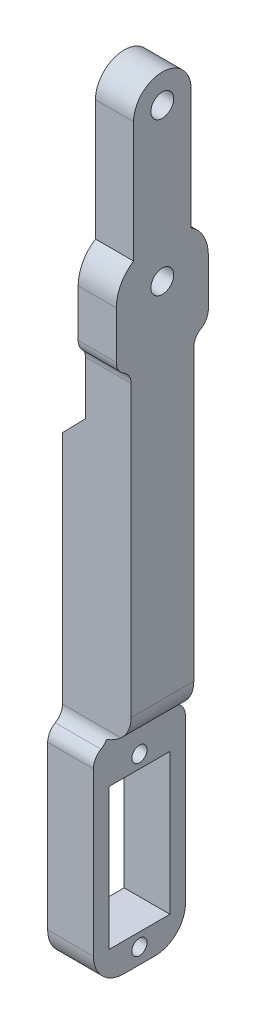
from build123d import *

# Parameters (mm, degrees)
SKETCH1_R               = 10
SKETCH1_R_2             = 0.8
SKETCH1_R_3             = 3.301767793
BOSS_EXTRUDE1_DEPTH     = 1.5
SKETCH2_R               = 10
BOSS_EXTRUDE2_DEPTH     = 9
CUT_EXTRUDE1_DEPTH      = 93.583714931
CUT_EXTRUDE1_DEPTH_BACK = 93.583714931
SKETCH3_R               = 1.5
FILLET1_R               = 5
SKETCH4_R               = 1.5
BOSS_EXTRUDE3_DEPTH     = 5
CUT_EXTRUDE2_DEPTH      = 4
FILLET3_R               = 2
SKETCH6_W               = 12.069016708
SKETCH6_H               = 36.150412664
BOSS_EXTRUDE4_DEPTH     = 9
CUT_EXTRUDE3_DEPTH      = 112.059195252
CUT_EXTRUDE3_DEPTH_BACK = 112.059195252
CUT_EXTRUDE4_DEPTH      = 111.336877259
CUT_EXTRUDE4_DEPTH_BACK = 111.336877259
SKETCH8_R               = 1
SKETCH8_W               = 8
SKETCH8_H               = 18.5
FILLET4_R               = 4
SKETCH9_W               = 24.382356312
SKETCH9_H               = 35.371587325
CUT_EXTRUDE5_DEPTH      = 3
FILLET5_R               = 4
SKETCH10_R              = 20.065343601
CUT_EXTRUDE6_DEPTH      = 3
CUT_EXTRUDE7_DEPTH      = 111.33687725
CUT_EXTRUDE7_DEPTH_BACK = 111.33687725
FILLET6_R               = 2
CHAMFER1_SIZE           = 3


# Some blends are built 0.0001 mm under size
with BuildPart() as part:
    # Sketch1 → Boss-Extrude1 (new body)
    with BuildSketch(Plane(origin=(0, 0, 0), x_dir=(0, 0, -1), z_dir=(1, 0, 0))):
        with Locations((2.983378847, 10.826778074)):
            Circle(SKETCH1_R)
        with Locations((2.983378847, 18.576778074)):
            Circle(SKETCH1_R_2, mode=Mode.SUBTRACT)
        with Locations((2.983378847, 3.076778074)):
            Circle(SKETCH1_R_2, mode=Mode.SUBTRACT)
        with Locations((-3.266621153, 10.826778074)):
            Circle(SKETCH1_R_2, mode=Mode.SUBTRACT)
        with Locations((9.233378847, 10.826778074)):
            Circle(SKETCH1_R_2, mode=Mode.SUBTRACT)
        with Locations((2.983378847, 10.826778074)):
            Circle(SKETCH1_R_3, mode=Mode.SUBTRACT)
    extrude(amount=BOSS_EXTRUDE1_DEPTH)

    # Sketch2 → Boss-Extrude2 (add)
    with BuildSketch(Plane.ZY):
        with BuildLine():
            Line((-15.531923741, 90.826778074), (9.565166047, 90.826778074))
            Line((9.565166047, 90.826778074), (9.565166047, 10.826778074))
            ThreePointArc((9.565166047, 10.826778074), (-2.983378847, -1.721766821), (-15.531923741, 10.826778074))
            Line((-15.531923741, 10.826778074), (-15.531923741, 90.826778074))
        make_face()
        with Locations((-2.983378847, 10.826778074)):
            Circle(SKETCH2_R, mode=Mode.SUBTRACT)
    extrude(amount=-BOSS_EXTRUDE2_DEPTH)

    # Sketch3 → Cut-Extrude1 (cut, two sides: drawn at the far end of the back side and taken through both)
    with BuildSketch(Plane(origin=(9, 0, 0), x_dir=(0, 0, -1), z_dir=(1, 0, 0)).offset(-CUT_EXTRUDE1_DEPTH_BACK)):
        with Locations((2.983378847, 85.826778074)):
            Circle(SKETCH3_R)
        with BuildLine():
            Line((-3.051129507, 36.150412664), (-3.051129507, 97.572569437))
            Line((-3.051129507, 97.572569437), (-16.389018159, 97.572569437))
            Line((-16.389018159, 97.572569437), (-16.389018159, 8.14109285))
            Line((-16.389018159, 8.14109285), (-9.565166047, 10.826778074))
            add(Edge.make_bspline(
                [(-9.565166047, 10.826778074), (-9.644230884, 15.122204253), (-6.916245701, 23.507010268), (-3.42826878, 31.561714956), (-3.051129507, 36.150412664)],
                knots=[0, 0, 0, 0, 0.482384809, 1, 1, 1, 1], degree=3))
        make_face()
        with BuildLine():
            Line((22.355775853, 8.14109285), (15.531923741, 10.826778074))
            add(Edge.make_bspline(
                [(15.531923741, 10.826778074), (15.610988578, 15.122204253), (12.883003395, 23.507010268), (9.395026474, 31.561714956), (9.017887201, 36.150412664)],
                knots=[0, 0, 0, 0, 0.482384809, 1, 1, 1, 1], degree=3))
            Line((9.017887201, 36.150412664), (9.017887201, 97.572569437))
            Line((9.017887201, 97.572569437), (22.355775853, 97.572569437))
            Line((22.355775853, 97.572569437), (22.355775853, 8.14109285))
        make_face()
    extrude(amount=CUT_EXTRUDE1_DEPTH + CUT_EXTRUDE1_DEPTH_BACK, mode=Mode.SUBTRACT)

    # Fillet1
    fillet1_edges = [part.edges().sort_by_distance(p)[0] for p in [
        (4.5, 90.826778074, 3.051129507),
        (4.5, 90.826778074, -9.017887201),
    ]]
    fillet(fillet1_edges, radius=FILLET1_R)

    # Sketch4 → Boss-Extrude3 (add)
    with BuildSketch(Plane(origin=(9, 0, 0), x_dir=(0, 0, -1), z_dir=(1, 0, 0))):
        with BuildLine():
            Line((-0.788675957, 85.826778074), (-0.788675957, 105.826778074))
            ThreePointArc((-0.788675957, 105.826778074), (2.983378847, 109.598832877), (6.755433651, 105.826778074))
            Line((6.755433651, 105.826778074), (6.755433651, 85.826778074))
            ThreePointArc((6.755433651, 85.826778074), (2.983378847, 82.05472327), (-0.788675957, 85.826778074))
        make_face()
        with Locations((2.983378847, 105.826778074)):
            Circle(SKETCH4_R, mode=Mode.SUBTRACT)
        with Locations((2.983378847, 85.826778074)):
            Circle(SKETCH4_R, mode=Mode.SUBTRACT)
    extrude(amount=-BOSS_EXTRUDE3_DEPTH)

    # Sketch5 → Cut-Extrude2 (cut)
    with BuildSketch(Plane.ZY):
        Polygon((3.051129507, 66.690354093), (-0.520583075, 90.618436978), (8.994411849, 90.618436978), (4.452818785, 66.690354093), align=None)
        Polygon((-9.017887201, 66.690354093), (-5.446174619, 90.618436978), (-12.469802715, 95.280611626), (-31.447569196, 66.690354093), align=None)
    extrude(amount=-CUT_EXTRUDE2_DEPTH, mode=Mode.SUBTRACT)

    # Fillet3
    fillet3_edges = [part.edges().sort_by_distance(p)[0] for p in [
        (2, 90.618436978, -5.446174619),
        (2, 90.618436978, -0.520583075),
    ]]
    fillet(fillet3_edges, radius=FILLET3_R)

    # Sketch6 → Boss-Extrude4 (add)
    with BuildSketch(Plane(origin=(9, 0, 0), x_dir=(0, 0, -1), z_dir=(1, 0, 0))):
        with Locations((2.983378847, 18.075206332)):
            Rectangle(SKETCH6_W, SKETCH6_H)
    extrude(amount=-BOSS_EXTRUDE4_DEPTH)

    # Sketch7 → Cut-Extrude3 (cut, two sides: drawn at the far end of the back side and taken through both)
    with BuildSketch(Plane(origin=(9, 0, 0), x_dir=(0, 0, -1), z_dir=(1, 0, 0)).offset(-CUT_EXTRUDE3_DEPTH_BACK)):
        Polygon((-3.051129507, -1.9847985), (-23.499593466, -1.9847985), (-3.051129507, 36.150412664), (-3.051129507, 6.693164213), (9.017887201, 6.693164213), (9.017887201, 36.150412664), (33.091996179, 2.744303699), (9.017887201, -7.659721138), align=None)
    extrude(amount=CUT_EXTRUDE3_DEPTH + CUT_EXTRUDE3_DEPTH_BACK, mode=Mode.SUBTRACT)

    # Sketch8 → Cut-Extrude4 (cut, two sides: drawn at the far end of the back side and taken through both)
    with BuildSketch(Plane(origin=(9, 0, 0), x_dir=(0, 0, -1), z_dir=(1, 0, 0)).offset(-CUT_EXTRUDE4_DEPTH_BACK)):
        with Locations((2.983378847, 30.648164213)):
            Circle(SKETCH8_R)
        with Locations((2.983378847, 8.738164213)):
            Circle(SKETCH8_R)
        with Locations((2.983378847, 19.693164213)):
            Rectangle(SKETCH8_W, SKETCH8_H)
    extrude(amount=CUT_EXTRUDE4_DEPTH + CUT_EXTRUDE4_DEPTH_BACK, mode=Mode.SUBTRACT)

    # Fillet4
    fillet4_edges = [part.edges().sort_by_distance(p)[0] for p in [
        (4.5, 6.693164213, -9.017887201),
        (4.5, 6.693164213, 3.051129507),
    ]]
    fillet(fillet4_edges, radius=FILLET4_R)

    # Sketch9 → Cut-Extrude5 (cut)
    with BuildSketch(Plane(origin=(9, 0, 0), x_dir=(0, 0, -1), z_dir=(1, 0, 0))):
        with Locations((3.21232116, 16.771571926)):
            Rectangle(SKETCH9_W, SKETCH9_H)
    extrude(amount=-CUT_EXTRUDE5_DEPTH, mode=Mode.SUBTRACT)

    # Fillet5
    # the kernel refuses this fillet: 4 mm, written as the material it takes off along each edge
    with BuildSketch(Plane(origin=(9, 34.457365588, -18.700345567), x_dir=(0, 1, 0), z_dir=(0, 0, 1))) as fillet5_piece_1:
        with BuildLine():
            CenterArc((3.872983346, 4), FILLET5_R, 194.477512186, 75.522487814)
            Line((0, 3), (-0.077459667, 2.98))
            ThreePointArc((-0.077459667, 2.98), (-0.08, 1.5), (-0.08, 0))
            Line((-0.08, 0), (0, -0.08))
            Line((0, -0.08), (3.872983346, -0.08))
            Line((3.872983346, -0.08), (3.872983346, 0))
        make_face()
    extrude(amount=31.43393344, mode=Mode.SUBTRACT)

    # Sketch10 → Cut-Extrude6 (cut)
    with BuildSketch(Plane.ZY):
        with Locations((-2.983378847, 85.826778074)):
            Circle(SKETCH10_R)
    extrude(amount=-CUT_EXTRUDE6_DEPTH, mode=Mode.SUBTRACT)

    # Sketch11 → Cut-Extrude7 (cut, two sides: drawn at the far end of the back side and taken through both)
    with BuildSketch(Plane.ZY.offset(-CUT_EXTRUDE7_DEPTH_BACK)):
        with BuildLine():
            Line((-7.109989343, 76.258566083), (-7.109989343, 35.357320381))
            ThreePointArc((-7.109989343, 35.357320381), (-9.017887201, 33.449422522), (-10.925785059, 35.357320381))
            Line((-10.925785059, 35.357320381), (-10.925785059, 76.258566083))
            ThreePointArc((-10.925785059, 76.258566083), (-9.017887201, 78.166463942), (-7.109989343, 76.258566083))
        make_face()
        with BuildLine():
            Line((1.103749815, 76.258566083), (1.103749815, 35.357320381))
            ThreePointArc((1.103749815, 35.357320381), (3.011647673, 33.449422522), (4.919545531, 35.357320381))
            Line((4.919545531, 35.357320381), (4.919545531, 76.258566083))
            ThreePointArc((4.919545531, 76.258566083), (3.011647673, 78.166463942), (1.103749815, 76.258566083))
        make_face()
    extrude(amount=CUT_EXTRUDE7_DEPTH + CUT_EXTRUDE7_DEPTH_BACK, mode=Mode.SUBTRACT)

    # Fillet6
    fillet6_edges = [part.edges().sort_by_distance(p)[0] for p in [
        (3, 33.449422522, -9.017887201),
        (6.5, 78.166463942, -9.017887201),
        (3, 33.449831083, 3.051129507),
        (6.5, 78.166055381, 3.051129507),
    ]]
    fillet(fillet6_edges, radius=FILLET6_R)

    # Chamfer1
    chamfer1_edges = [part.edges().sort_by_distance(p)[0] for p in [
        (3, 65.761444608, -3.003546718),
    ]]
    chamfer(chamfer1_edges, length=CHAMFER1_SIZE - 0.0001)  # a hair under: the kernel refuses the full size


solid = part.part
